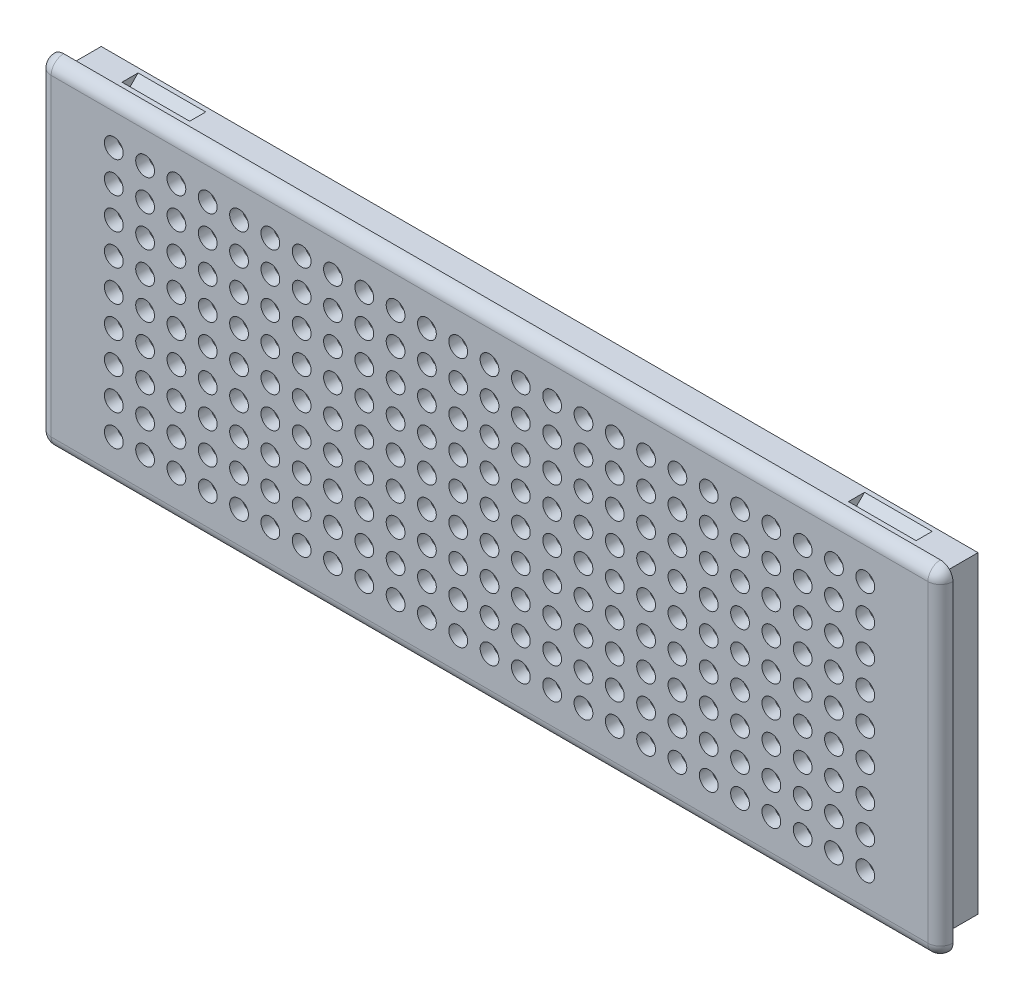
from build123d import *

# Parameters (mm, degrees)
SKETCH1_W            = 140
SKETCH1_H            = 50
SKETCH1_W_2          = 136
SKETCH1_H_2          = 46
BOSS_EXTRUDE1_DEPTH  = 6
SKETCH2_W            = 144
SKETCH2_H            = 54
SKETCH2_W_2          = 140
SKETCH2_H_2          = 50
SKETCH2_W_3          = 136
SKETCH2_H_3          = 46
BOSS_EXTRUDE3_DEPTH  = 2
FILLET1_R            = 2
FILLET2_R            = 2
CAVITY1_START        = -16.970562748
CAVITY1_OUTLINE_W    = 10
CAVITY1_OUTLINE_H    = 2.615223689
CAVITY1_DEPTH        = 1.414213562
CAVITY1_START_2      = 18.384776311
CAVITY1_2_OUTLINE_W  = 10
CAVITY1_2_OUTLINE_H  = 2.443650814
CAVITY1_2_DEPTH      = 1.414213562
CUT_EXTRUDE1_START   = -0.4
CUT_EXTRUDE1_DEPTH   = 10.8
MIRROR2_START        = -0.4
MIRROR2_COPY_1_DEPTH = 10.8
CUT_EXTRUDE2_REACH   = 79.311
SKETCH4_R            = 1.5
LPATTERN1_COUNT      = 14
LPATTERN1_PITCH      = 5
LPATTERN1_COUNT_DIR2 = 5
LPATTERN1_PITCH_DIR2 = 5
MIRROR3_START        = 6
MIRROR3_OUTLINE_R    = 1.5
MIRROR3_DEPTH        = 2
MIRROR4_START        = 6
MIRROR4_OUTLINE_R    = 1.5
MIRROR4_DEPTH        = 2


# Read off the part's stored shape, not the designer's step: Cavity1, Mirror3, Mirror4
# Some blends are built 0.0001 mm under size
with BuildPart() as part:
    # Sketch1 → Boss-Extrude1 (new body)
    with BuildSketch(Plane.XY):
        Rectangle(SKETCH1_W, SKETCH1_H)
        Rectangle(SKETCH1_W_2, SKETCH1_H_2, mode=Mode.SUBTRACT)
    extrude(amount=BOSS_EXTRUDE1_DEPTH)

    # Sketch2 → Boss-Extrude3 (add)
    # profile 1 of 3: a face of its own
    with BuildSketch(Plane.XY.offset(6)):
        Rectangle(SKETCH2_W, SKETCH2_H)
        Rectangle(SKETCH2_W_2, SKETCH2_H_2, mode=Mode.SUBTRACT)
    # profile 2 of 3: a face of its own
    with BuildSketch(Plane.XY.offset(6)):
        Rectangle(SKETCH2_W_2, SKETCH2_H_2)
        Rectangle(SKETCH2_W_3, SKETCH2_H_3, mode=Mode.SUBTRACT)
    # profile 3 of 3: a face of its own
    with BuildSketch(Plane.XY.offset(6)):
        Rectangle(SKETCH2_W_3, SKETCH2_H_3)
    extrude(amount=BOSS_EXTRUDE3_DEPTH)

    # Fillet1
    fillet1_edges = [part.edges().sort_by_distance(p)[0] for p in [
        (0, -27, 8),
        (-72, 0, 8),
        (0, 27, 8),
        (72, 0, 8),
    ]]
    fillet(fillet1_edges, radius=FILLET1_R - 0.0001)  # a hair under: the kernel refuses the full size

    # Fillet2
    # the kernel refuses this fillet: 2 mm, written as the material it takes off along each edge
    with BuildSketch(Plane(origin=(-70, 25, 8), x_dir=(0, 1, 0), z_dir=(1, 0, 0))) as fillet2_piece_1:
        with BuildLine():
            CenterArc((0.0001, -1.9999), 1.9999, 0, 90)
            Line((2, -1.9999), (2, 0))
            Line((2, 0), (0.0001, 0))
        make_face()
    revolve(axis=Axis((-70, 25, 8), (0, 0, 1)), revolution_arc=90, mode=Mode.SUBTRACT)
    with BuildSketch(Plane(origin=(70, 25, 8), x_dir=(1, 0, 0), z_dir=(0, -1, 0))) as fillet2_piece_2:
        with BuildLine():
            CenterArc((0.0001, -1.9999), 1.9999, 0, 90)
            Line((2, -1.9999), (2, 0))
            Line((2, 0), (0.0001, 0))
        make_face()
    revolve(axis=Axis((70, 25, 8), (0, 0, 1)), revolution_arc=90, mode=Mode.SUBTRACT)
    with BuildSketch(Plane(origin=(-70, -25, 8), x_dir=(-1, 0, 0), z_dir=(0, 1, 0))) as fillet2_piece_3:
        with BuildLine():
            CenterArc((0.0001, -1.9999), 1.9999, 0, 90)
            Line((2, -1.9999), (2, 0))
            Line((2, 0), (0.0001, 0))
        make_face()
    revolve(axis=Axis((-70, -25, 8), (0, 0, 1)), revolution_arc=90, mode=Mode.SUBTRACT)
    with BuildSketch(Plane(origin=(70, -25, 8), x_dir=(0, -1, 0), z_dir=(-1, 0, 0))) as fillet2_piece_4:
        with BuildLine():
            CenterArc((0.0001, -1.9999), 1.9999, 0, 90)
            Line((2, -1.9999), (2, 0))
            Line((2, 0), (0.0001, 0))
        make_face()
    revolve(axis=Axis((70, -25, 8), (0, 0, 1)), revolution_arc=90, mode=Mode.SUBTRACT)
    with BuildSketch(Plane(origin=(72, -27, 1), x_dir=(-1, 0, 0), z_dir=(0, 0, 1)), Plane(origin=(72, 27, 1), x_dir=(0, -1, 0), z_dir=(0, 0, 1))) as fillet2_piece_5:
        with BuildLine():
            CenterArc((FILLET2_R, -FILLET2_R), FILLET2_R, 90, 90)
            Line((0, -FILLET2_R), (0, 0))
            Line((0, 0), (FILLET2_R, 0))
        make_face()
    extrude(amount=7, mode=Mode.SUBTRACT)
    with BuildSketch(Plane(origin=(-72, -27, 1), x_dir=(1, 0, 0), z_dir=(0, 0, 1)), Plane(origin=(-72, 27, 1), x_dir=(0, -1, 0), z_dir=(0, 0, 1))) as fillet2_piece_6:
        with BuildLine():
            CenterArc((FILLET2_R, FILLET2_R), FILLET2_R, 180, 90)
            Line((0, FILLET2_R), (0, 0))
            Line((0, 0), (FILLET2_R, 0))
        make_face()
    extrude(amount=7, mode=Mode.SUBTRACT)

    # Cavity1 outline → Cavity1 (cut)
    with BuildSketch(Plane(origin=(0, 0, 0), x_dir=(1, 0, 0), z_dir=(0, 0.707106781186543, 0.707106781186552)).offset(CAVITY1_START)):
        with Locations((58, -19.692388155)):
            Rectangle(CAVITY1_OUTLINE_W, CAVITY1_OUTLINE_H)
        with Locations((-58, -19.692388155)):
            Rectangle(CAVITY1_OUTLINE_W, CAVITY1_OUTLINE_H)
    extrude(amount=CAVITY1_DEPTH, mode=Mode.SUBTRACT)

    # Cavity1 2 outline → Cavity1 2 (cut)
    with BuildSketch(Plane(origin=(0, 0, 0), x_dir=(1, 0, 0), z_dir=(0, 0.707106781186543, 0.707106781186552)).offset(CAVITY1_START_2)):
        with Locations((58, 16.778174593)):
            Rectangle(CAVITY1_2_OUTLINE_W, CAVITY1_2_OUTLINE_H)
        with Locations((-58, 16.778174593)):
            Rectangle(CAVITY1_2_OUTLINE_W, CAVITY1_2_OUTLINE_H)
    extrude(amount=CAVITY1_2_DEPTH, mode=Mode.SUBTRACT)

    # Sketch3 → Cut-Extrude1 (cut)
    # profile 1 of 2: a face of its own
    with BuildSketch(Plane.ZY.offset(-63).offset(CUT_EXTRUDE1_START)):
        Polygon((3.482842712, 25.2), (0.517157288, 25.2), (2, 23.717157288), align=None)
        Polygon((2, 24), (3, 25), (1, 25), align=None, mode=Mode.SUBTRACT)
    # profile 2 of 2: a face of its own
    with BuildSketch(Plane.ZY.offset(-63).offset(CUT_EXTRUDE1_START)):
        Polygon((1, 25), (2, 24), (3, 25), align=None)
    cut_extrude1 = extrude(amount=CUT_EXTRUDE1_DEPTH, mode=Mode.SUBTRACT)

    # Mirror1: Cut-Extrude1 across plane
    add(cut_extrude1.mirror(Plane(origin=(0, 0, 0), x_dir=(0, 0, 1), z_dir=(1, 0, 0))), mode=Mode.SUBTRACT)

    # Mirror2: Cut-Extrude1 across plane
    add(cut_extrude1.mirror(Plane.ZX), mode=Mode.SUBTRACT)

    # Mirror2 copy 1 sketch → Mirror2 copy 1 (cut)
    # profile 1 of 2: a face of its own
    with BuildSketch(Plane(origin=(-63, 0, 0), x_dir=(0, 0, 1), z_dir=(1, 0, 0)).offset(MIRROR2_START)):
        Polygon((3.482842712, 25.2), (0.517157288, 25.2), (2, 23.717157288), align=None)
        Polygon((2, 24), (3, 25), (1, 25), align=None, mode=Mode.SUBTRACT)
    # profile 2 of 2: a face of its own
    with BuildSketch(Plane(origin=(-63, 0, 0), x_dir=(0, 0, 1), z_dir=(1, 0, 0)).offset(MIRROR2_START)):
        Polygon((1, 25), (2, 24), (3, 25), align=None)
    extrude(amount=MIRROR2_COPY_1_DEPTH, mode=Mode.SUBTRACT)

    # Sketch4 → Cut-Extrude2 (cut, up to next)
    with BuildSketch(Plane.XY.offset(8), mode=Mode.PRIVATE) as cut_extrude2_sk1:
        with Locations((-5, 0)):
            Circle(SKETCH4_R)
    cut_extrude2_tool1 = extrude(cut_extrude2_sk1.sketch, amount=-CUT_EXTRUDE2_REACH, mode=Mode.PRIVATE) & part.part
    cut_extrude2 = cut_extrude2_tool1.solids().sort_by_distance((-5, 0, 8))[0]
    add(cut_extrude2, mode=Mode.SUBTRACT)

    # LPattern1: Cut-Extrude2 14 × 5
    with Locations(*[(i * LPATTERN1_PITCH, -j * LPATTERN1_PITCH_DIR2, 0) for i in range(LPATTERN1_COUNT) for j in range(LPATTERN1_COUNT_DIR2) if (i, j) != (0, 0)]):
        add(cut_extrude2, mode=Mode.SUBTRACT)

    # Mirror3 outline → Mirror3 (cut)
    with BuildSketch(Plane.XY.offset(MIRROR3_START)):
        with Locations((-40, -15)):
            Circle(MIRROR3_OUTLINE_R)
        with Locations((-40, -10)):
            Circle(MIRROR3_OUTLINE_R)
        with Locations((-40, -5)):
            Circle(MIRROR3_OUTLINE_R)
        with Locations((-40, 0)):
            Circle(MIRROR3_OUTLINE_R)
        with Locations((-35, -20)):
            Circle(MIRROR3_OUTLINE_R)
        with Locations((-35, -15)):
            Circle(MIRROR3_OUTLINE_R)
        with Locations((-35, -10)):
            Circle(MIRROR3_OUTLINE_R)
        with Locations((-35, -5)):
            Circle(MIRROR3_OUTLINE_R)
        with Locations((-25, -15)):
            Circle(MIRROR3_OUTLINE_R)
        with Locations((-25, -20)):
            Circle(MIRROR3_OUTLINE_R)
        with Locations((-30, 0)):
            Circle(MIRROR3_OUTLINE_R)
        with Locations((-30, -5)):
            Circle(MIRROR3_OUTLINE_R)
        with Locations((-35, 0)):
            Circle(MIRROR3_OUTLINE_R)
        with Locations((-30, -20)):
            Circle(MIRROR3_OUTLINE_R)
        with Locations((-30, -15)):
            Circle(MIRROR3_OUTLINE_R)
        with Locations((-30, -10)):
            Circle(MIRROR3_OUTLINE_R)
        with Locations((-55, 0)):
            Circle(MIRROR3_OUTLINE_R)
        with Locations((-50, -20)):
            Circle(MIRROR3_OUTLINE_R)
        with Locations((-50, -15)):
            Circle(MIRROR3_OUTLINE_R)
        with Locations((-50, -10)):
            Circle(MIRROR3_OUTLINE_R)
        with Locations((-55, -5)):
            Circle(MIRROR3_OUTLINE_R)
        with Locations((-55, -10)):
            Circle(MIRROR3_OUTLINE_R)
        with Locations((-55, -15)):
            Circle(MIRROR3_OUTLINE_R)
        with Locations((-55, -20)):
            Circle(MIRROR3_OUTLINE_R)
        with Locations((-45, -10)):
            Circle(MIRROR3_OUTLINE_R)
        with Locations((-45, -5)):
            Circle(MIRROR3_OUTLINE_R)
        with Locations((-45, 0)):
            Circle(MIRROR3_OUTLINE_R)
        with Locations((-40, -20)):
            Circle(MIRROR3_OUTLINE_R)
        with Locations((-45, -15)):
            Circle(MIRROR3_OUTLINE_R)
        with Locations((-45, -20)):
            Circle(MIRROR3_OUTLINE_R)
        with Locations((-50, 0)):
            Circle(MIRROR3_OUTLINE_R)
        with Locations((-50, -5)):
            Circle(MIRROR3_OUTLINE_R)
        with Locations((-10, 0)):
            Circle(MIRROR3_OUTLINE_R)
        with Locations((-10, -5)):
            Circle(MIRROR3_OUTLINE_R)
        with Locations((-15, -20)):
            Circle(MIRROR3_OUTLINE_R)
        with Locations((-15, -15)):
            Circle(MIRROR3_OUTLINE_R)
        with Locations((-15, -10)):
            Circle(MIRROR3_OUTLINE_R)
        with Locations((-15, -5)):
            Circle(MIRROR3_OUTLINE_R)
        with Locations((-10, -10)):
            Circle(MIRROR3_OUTLINE_R)
        with Locations((-10, -15)):
            Circle(MIRROR3_OUTLINE_R)
        with Locations((-10, -20)):
            Circle(MIRROR3_OUTLINE_R)
        with Locations((-15, 0)):
            Circle(MIRROR3_OUTLINE_R)
        with Locations((-20, -20)):
            Circle(MIRROR3_OUTLINE_R)
        with Locations((-25, 0)):
            Circle(MIRROR3_OUTLINE_R)
        with Locations((-25, -5)):
            Circle(MIRROR3_OUTLINE_R)
        with Locations((-25, -10)):
            Circle(MIRROR3_OUTLINE_R)
        with Locations((-20, -15)):
            Circle(MIRROR3_OUTLINE_R)
        with Locations((-20, -10)):
            Circle(MIRROR3_OUTLINE_R)
        with Locations((-20, -5)):
            Circle(MIRROR3_OUTLINE_R)
        with Locations((-20, 0)):
            Circle(MIRROR3_OUTLINE_R)
        with Locations((-60, 0)):
            Circle(MIRROR3_OUTLINE_R)
        with Locations((-60, -5)):
            Circle(MIRROR3_OUTLINE_R)
        with Locations((-60, -10)):
            Circle(MIRROR3_OUTLINE_R)
        with Locations((-60, -15)):
            Circle(MIRROR3_OUTLINE_R)
        with Locations((-60, -20)):
            Circle(MIRROR3_OUTLINE_R)
    extrude(amount=MIRROR3_DEPTH, mode=Mode.SUBTRACT)

    # Mirror4 outline → Mirror4 (cut)
    with BuildSketch(Plane.XY.offset(MIRROR4_START)):
        with Locations((-40, 15)):
            Circle(MIRROR4_OUTLINE_R)
        with Locations((-40, 10)):
            Circle(MIRROR4_OUTLINE_R)
        with Locations((-40, 5)):
            Circle(MIRROR4_OUTLINE_R)
        with Locations((-35, 20)):
            Circle(MIRROR4_OUTLINE_R)
        with Locations((-35, 15)):
            Circle(MIRROR4_OUTLINE_R)
        with Locations((-35, 10)):
            Circle(MIRROR4_OUTLINE_R)
        with Locations((-35, 5)):
            Circle(MIRROR4_OUTLINE_R)
        with Locations((-25, 15)):
            Circle(MIRROR4_OUTLINE_R)
        with Locations((-25, 20)):
            Circle(MIRROR4_OUTLINE_R)
        with Locations((-30, 5)):
            Circle(MIRROR4_OUTLINE_R)
        with Locations((-30, 20)):
            Circle(MIRROR4_OUTLINE_R)
        with Locations((-30, 15)):
            Circle(MIRROR4_OUTLINE_R)
        with Locations((-30, 10)):
            Circle(MIRROR4_OUTLINE_R)
        with Locations((-50, 20)):
            Circle(MIRROR4_OUTLINE_R)
        with Locations((-50, 15)):
            Circle(MIRROR4_OUTLINE_R)
        with Locations((-50, 10)):
            Circle(MIRROR4_OUTLINE_R)
        with Locations((-55, 5)):
            Circle(MIRROR4_OUTLINE_R)
        with Locations((-55, 10)):
            Circle(MIRROR4_OUTLINE_R)
        with Locations((-55, 15)):
            Circle(MIRROR4_OUTLINE_R)
        with Locations((-55, 20)):
            Circle(MIRROR4_OUTLINE_R)
        with Locations((-45, 10)):
            Circle(MIRROR4_OUTLINE_R)
        with Locations((-45, 5)):
            Circle(MIRROR4_OUTLINE_R)
        with Locations((-40, 20)):
            Circle(MIRROR4_OUTLINE_R)
        with Locations((-45, 15)):
            Circle(MIRROR4_OUTLINE_R)
        with Locations((-45, 20)):
            Circle(MIRROR4_OUTLINE_R)
        with Locations((-50, 5)):
            Circle(MIRROR4_OUTLINE_R)
        with Locations((-5, 10)):
            Circle(MIRROR4_OUTLINE_R)
        with Locations((-5, 5)):
            Circle(MIRROR4_OUTLINE_R)
        with Locations((0, 20)):
            Circle(MIRROR4_OUTLINE_R)
        with Locations((-5, 15)):
            Circle(MIRROR4_OUTLINE_R)
        with Locations((-5, 20)):
            Circle(MIRROR4_OUTLINE_R)
        with Locations((-10, 5)):
            Circle(MIRROR4_OUTLINE_R)
        with Locations((0, 15)):
            Circle(MIRROR4_OUTLINE_R)
        with Locations((0, 10)):
            Circle(MIRROR4_OUTLINE_R)
        with Locations((0, 5)):
            Circle(MIRROR4_OUTLINE_R)
        with Locations((5, 20)):
            Circle(MIRROR4_OUTLINE_R)
        with Locations((5, 15)):
            Circle(MIRROR4_OUTLINE_R)
        with Locations((5, 10)):
            Circle(MIRROR4_OUTLINE_R)
        with Locations((5, 5)):
            Circle(MIRROR4_OUTLINE_R)
        with Locations((-15, 20)):
            Circle(MIRROR4_OUTLINE_R)
        with Locations((-15, 15)):
            Circle(MIRROR4_OUTLINE_R)
        with Locations((-15, 10)):
            Circle(MIRROR4_OUTLINE_R)
        with Locations((-15, 5)):
            Circle(MIRROR4_OUTLINE_R)
        with Locations((-10, 10)):
            Circle(MIRROR4_OUTLINE_R)
        with Locations((-10, 15)):
            Circle(MIRROR4_OUTLINE_R)
        with Locations((-10, 20)):
            Circle(MIRROR4_OUTLINE_R)
        with Locations((-20, 20)):
            Circle(MIRROR4_OUTLINE_R)
        with Locations((-25, 5)):
            Circle(MIRROR4_OUTLINE_R)
        with Locations((-25, 10)):
            Circle(MIRROR4_OUTLINE_R)
        with Locations((-20, 15)):
            Circle(MIRROR4_OUTLINE_R)
        with Locations((-20, 10)):
            Circle(MIRROR4_OUTLINE_R)
        with Locations((-20, 5)):
            Circle(MIRROR4_OUTLINE_R)
        with Locations((-60, 5)):
            Circle(MIRROR4_OUTLINE_R)
        with Locations((-60, 10)):
            Circle(MIRROR4_OUTLINE_R)
        with Locations((-60, 15)):
            Circle(MIRROR4_OUTLINE_R)
        with Locations((-60, 20)):
            Circle(MIRROR4_OUTLINE_R)
        with Locations((40, 15)):
            Circle(MIRROR4_OUTLINE_R)
        with Locations((40, 10)):
            Circle(MIRROR4_OUTLINE_R)
        with Locations((40, 5)):
            Circle(MIRROR4_OUTLINE_R)
        with Locations((35, 20)):
            Circle(MIRROR4_OUTLINE_R)
        with Locations((35, 15)):
            Circle(MIRROR4_OUTLINE_R)
        with Locations((35, 10)):
            Circle(MIRROR4_OUTLINE_R)
        with Locations((35, 5)):
            Circle(MIRROR4_OUTLINE_R)
        with Locations((25, 15)):
            Circle(MIRROR4_OUTLINE_R)
        with Locations((25, 20)):
            Circle(MIRROR4_OUTLINE_R)
        with Locations((30, 5)):
            Circle(MIRROR4_OUTLINE_R)
        with Locations((30, 20)):
            Circle(MIRROR4_OUTLINE_R)
        with Locations((30, 15)):
            Circle(MIRROR4_OUTLINE_R)
        with Locations((30, 10)):
            Circle(MIRROR4_OUTLINE_R)
        with Locations((50, 20)):
            Circle(MIRROR4_OUTLINE_R)
        with Locations((50, 15)):
            Circle(MIRROR4_OUTLINE_R)
        with Locations((50, 10)):
            Circle(MIRROR4_OUTLINE_R)
        with Locations((55, 5)):
            Circle(MIRROR4_OUTLINE_R)
        with Locations((55, 10)):
            Circle(MIRROR4_OUTLINE_R)
        with Locations((55, 15)):
            Circle(MIRROR4_OUTLINE_R)
        with Locations((55, 20)):
            Circle(MIRROR4_OUTLINE_R)
        with Locations((45, 10)):
            Circle(MIRROR4_OUTLINE_R)
        with Locations((45, 5)):
            Circle(MIRROR4_OUTLINE_R)
        with Locations((40, 20)):
            Circle(MIRROR4_OUTLINE_R)
        with Locations((45, 15)):
            Circle(MIRROR4_OUTLINE_R)
        with Locations((45, 20)):
            Circle(MIRROR4_OUTLINE_R)
        with Locations((50, 5)):
            Circle(MIRROR4_OUTLINE_R)
        with Locations((10, 5)):
            Circle(MIRROR4_OUTLINE_R)
        with Locations((15, 20)):
            Circle(MIRROR4_OUTLINE_R)
        with Locations((15, 15)):
            Circle(MIRROR4_OUTLINE_R)
        with Locations((15, 10)):
            Circle(MIRROR4_OUTLINE_R)
        with Locations((15, 5)):
            Circle(MIRROR4_OUTLINE_R)
        with Locations((10, 10)):
            Circle(MIRROR4_OUTLINE_R)
        with Locations((10, 15)):
            Circle(MIRROR4_OUTLINE_R)
        with Locations((10, 20)):
            Circle(MIRROR4_OUTLINE_R)
        with Locations((20, 20)):
            Circle(MIRROR4_OUTLINE_R)
        with Locations((25, 5)):
            Circle(MIRROR4_OUTLINE_R)
        with Locations((25, 10)):
            Circle(MIRROR4_OUTLINE_R)
        with Locations((20, 15)):
            Circle(MIRROR4_OUTLINE_R)
        with Locations((20, 10)):
            Circle(MIRROR4_OUTLINE_R)
        with Locations((20, 5)):
            Circle(MIRROR4_OUTLINE_R)
        with Locations((60, 5)):
            Circle(MIRROR4_OUTLINE_R)
        with Locations((60, 10)):
            Circle(MIRROR4_OUTLINE_R)
        with Locations((60, 15)):
            Circle(MIRROR4_OUTLINE_R)
        with Locations((60, 20)):
            Circle(MIRROR4_OUTLINE_R)
    extrude(amount=MIRROR4_DEPTH, mode=Mode.SUBTRACT)


solid = part.part
